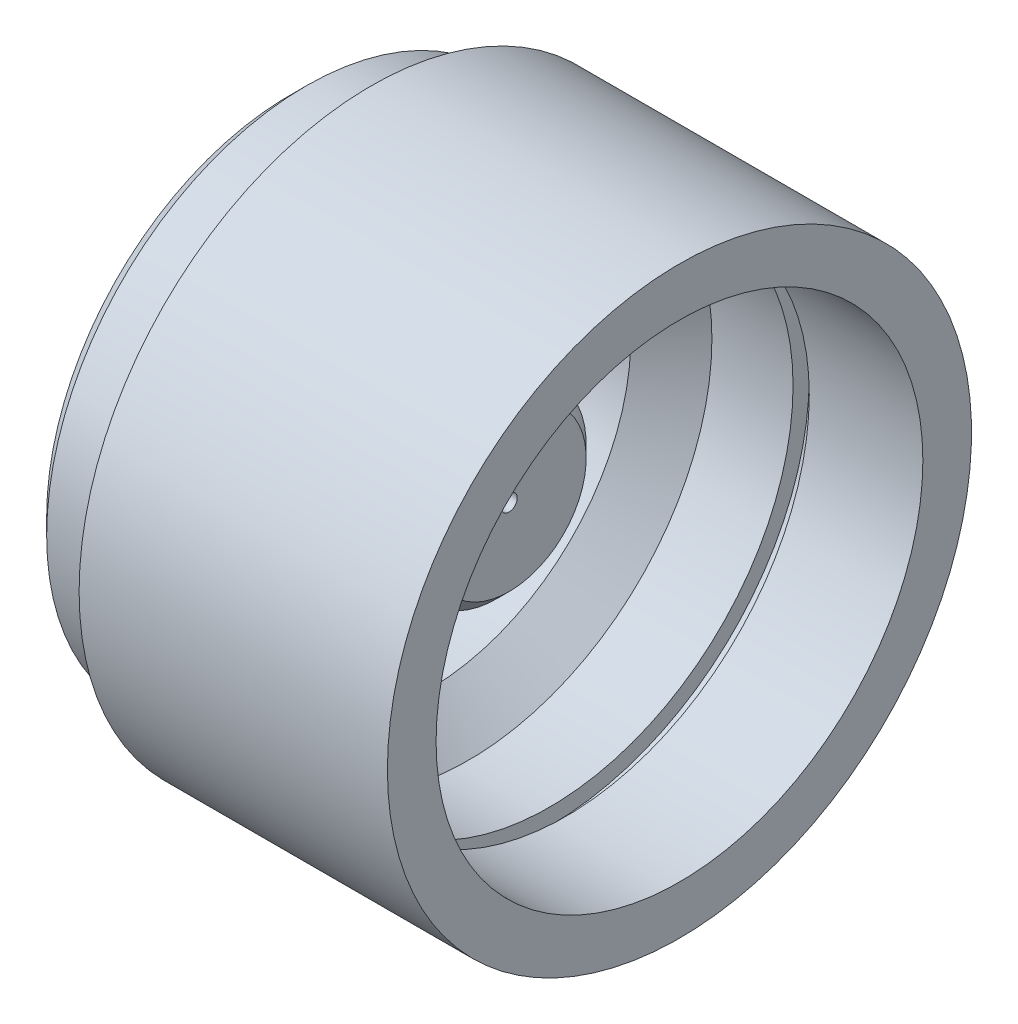
from build123d import *

# Parameters (mm, degrees)
DIAM_TRE_DU_PER_AGE_1_0_1_1_D     = 1
DIAM_TRE_DU_PER_AGE_1_0_1_1_DEPTH = 2
DIAM_TRE_DU_PER_AGE_1_0_1_1_TIP   = 0.30043031
DIAM_TRE_DU_PER_AGE_5_0_5_1_D     = 5
DIAM_TRE_DU_PER_AGE_5_0_5_1_DEPTH = 9.5
DIAM_TRE_DU_PER_AGE_5_0_5_1_TIP   = 1.502151548


with BuildPart() as part:
    # Esquisse7 → Révolution2 (revolve)
    with BuildSketch(Plane.XY):
        Polygon((0, 15), (0, 18), (-19, 18), (-19, 15), (-20, 15), (-20, 16), (-23, 16), (-24, 15), (-24, 8), (-23, 8), (-23, 0), (-10.5, 0), (-10.5, 4.75), (-11.25, 5.5), (-19.75, 5.5), (-20.5, 6.25), (-20.5, 11.75), (-19.75, 12.5), (-15.5, 12.5), (-13, 15), (-8, 15), (-8, 16), (-7, 16), (-7, 15), align=None)
    revolve(axis=Axis((-24, 0, 0), (1, 0, 0)))

    # Diamètre du perçage Ø1.0 (1)1
    with Locations(Plane(origin=(-10.5, 0, 0), x_dir=(0, 0, -1), z_dir=(1, 0, 0))):
        with Locations((0, 0)):
            Hole(DIAM_TRE_DU_PER_AGE_1_0_1_1_D / 2, depth=DIAM_TRE_DU_PER_AGE_1_0_1_1_DEPTH)
            with Locations((0, 0, -(DIAM_TRE_DU_PER_AGE_1_0_1_1_DEPTH + DIAM_TRE_DU_PER_AGE_1_0_1_1_TIP / 2))):  # 118° drill point
                Cone(0, DIAM_TRE_DU_PER_AGE_1_0_1_1_D / 2, DIAM_TRE_DU_PER_AGE_1_0_1_1_TIP, mode=Mode.SUBTRACT)

    # Diamètre du perçage Ø5.0 (5)1
    with Locations(Plane.ZY.offset(23)):
        with Locations((0, 0)):
            Hole(DIAM_TRE_DU_PER_AGE_5_0_5_1_D / 2, depth=DIAM_TRE_DU_PER_AGE_5_0_5_1_DEPTH)
            with Locations((0, 0, -(DIAM_TRE_DU_PER_AGE_5_0_5_1_DEPTH + DIAM_TRE_DU_PER_AGE_5_0_5_1_TIP / 2))):  # 118° drill point
                Cone(0, DIAM_TRE_DU_PER_AGE_5_0_5_1_D / 2, DIAM_TRE_DU_PER_AGE_5_0_5_1_TIP, mode=Mode.SUBTRACT)


solid = part.part
